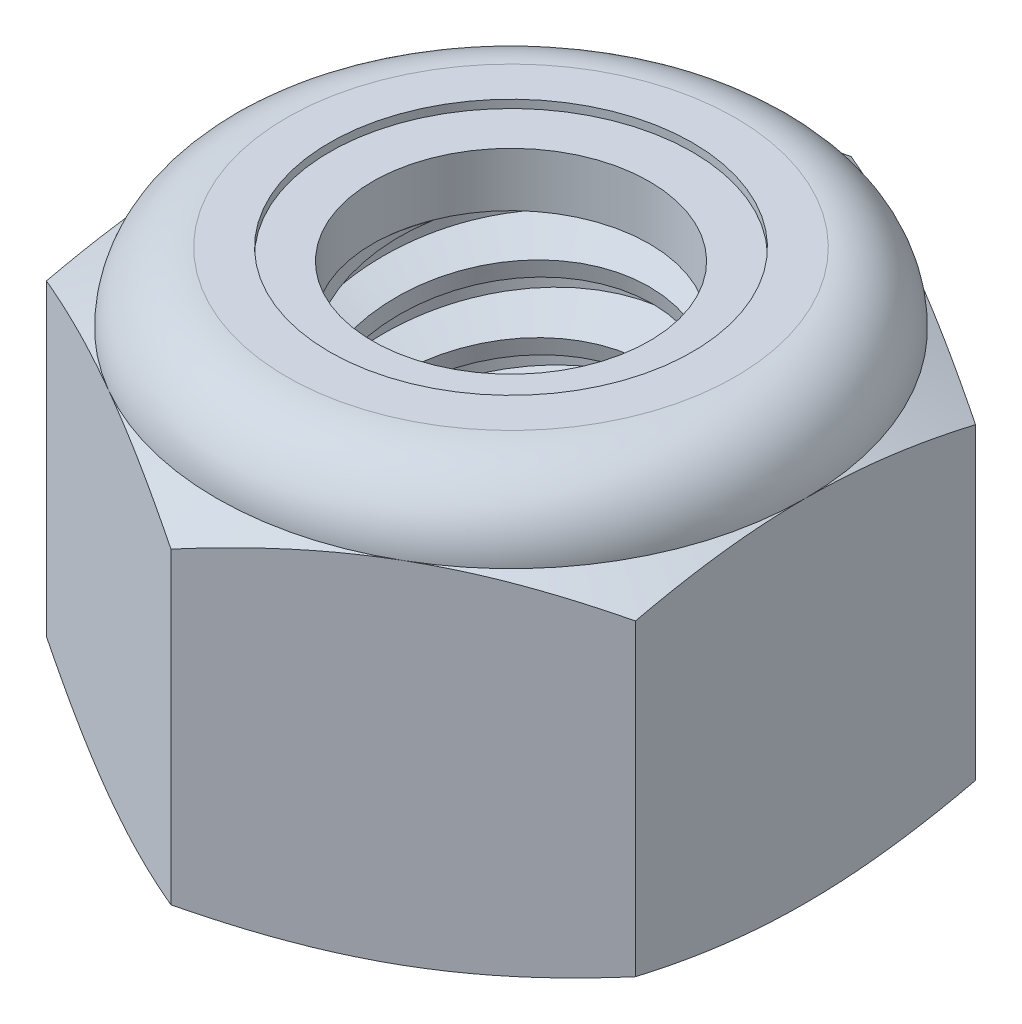
from build123d import *

# Parameters (mm, degrees)
EXTRUDE1_DEPTH       = 7.9375
SKETCH2_W            = 3.175
SKETCH2_H            = 7.9375
LPATTERN1_COUNT      = 6
LPATTERN1_PITCH      = 1.27
LPATTERN1_COUNT_DIR2 = 2
LPATTERN1_PITCH_DIR2 = 1.27


with BuildPart() as part:
    # Sketch1 → Extrude1 (new body)
    with BuildSketch(Plane(origin=(0, 0, 0), x_dir=(1, 0, 0), z_dir=(0, 1, 0))):
        Polygon((0, 6.415804866), (-5.55625, 3.207902433), (-5.55625, -3.207902433), (0, -6.415804866), (5.55625, -3.207902433), (5.55625, 3.207902433), align=None)
    extrude(amount=EXTRUDE1_DEPTH)

    # Sketch4 → Cut-Revolve2 (revolve, cut)
    with BuildSketch(Plane(origin=(0, 0, 0), x_dir=(0, 0, -1), z_dir=(1, 0, 0))):
        Polygon((0, 7.9375), (3.175, 7.9375), (2.609908356, 7.673993439), (2.609908356, 0.263506561), (3.175, 0), (0, 0), align=None)
    revolve(axis=Axis((0, 7.9375, 0), (0, 1, 0)), mode=Mode.SUBTRACT)


with BuildPart() as body_2:
    # Sketch2 → Revolve1 (revolve)
    with BuildSketch(Plane(origin=(0, 0, 0), x_dir=(0, 0, -1), z_dir=(1, 0, 0))):
        with Locations((1.5875, 3.96875)):
            Rectangle(SKETCH2_W, SKETCH2_H)
    revolve(axis=Axis((0, -3.175, 0), (0, 1, 0)))

    # Sketch3 → Cut-Revolve1 (revolve, cut)
    with BuildSketch(Plane(origin=(0, 0, 0), x_dir=(0, 0, -1), z_dir=(1, 0, 0))):
        Polygon((3.206133436, 7.781832818), (3.424067492, 6.692162542), (2.672175229, 6.946518763), (2.609908356, 7.257853128), align=None)
    cut_revolve1 = revolve(axis=Axis((0, 7.9375, 0.272704483), (0, -0.9805806756909201, -0.19611613513818418)), mode=Mode.SUBTRACT)

    # LPattern1: Cut-Revolve1 6 × 2
    with Locations(*[Vector(0, -1, 0) * (i * LPATTERN1_PITCH) + Vector(0, 1, 0) * (j * LPATTERN1_PITCH_DIR2) for i in range(LPATTERN1_COUNT) for j in range(LPATTERN1_COUNT_DIR2) if (i, j) != (0, 0)]):
        add(cut_revolve1, mode=Mode.SUBTRACT)


with BuildPart() as part_1:
    add(part.part)

    # Combine1: cut body 2
    add(body_2.part, mode=Mode.SUBTRACT)

    # Sketch5 → Cut-Revolve3 (revolve, cut)
    with BuildSketch(Plane(origin=(0, 0, 0), x_dir=(0, 0, -1), z_dir=(1, 0, 0))):
        with BuildLine():
            Line((0, 0), (5.55625, 0))
            Line((5.55625, 0), (6.415804866, 0.400817017))
            Line((6.415804866, 0.400817017), (6.415804866, 6.213766317))
            Line((6.415804866, 6.213766317), (5.55625, 6.614583333))
            ThreePointArc((5.55625, 6.614583333), (5.168776679, 7.550026679), (4.233333333, 7.9375))
            Line((4.233333333, 7.9375), (4.233333333, 9.2075))
            Line((4.233333333, 9.2075), (7.685804866, 9.2075))
            Line((7.685804866, 9.2075), (7.685804866, -1.27))
            Line((7.685804866, -1.27), (0, -1.27))
            Line((0, -1.27), (0, 0))
        make_face()
    revolve(axis=Axis((0, 0, 0), (0, 1, 0)), mode=Mode.SUBTRACT)

    # Sketch6 → Cut-Revolve4 (revolve, cut)
    with BuildSketch(Plane(origin=(0, 0, 0), x_dir=(0, 0, -1), z_dir=(1, 0, 0))):
        with BuildLine():
            Line((0, 6.614583333), (5.40385, 6.614583333))
            ThreePointArc((5.40385, 6.614583333), (5.061013606, 7.442263606), (4.233333333, 7.7851))
            Line((4.233333333, 7.7851), (3.421620845, 7.7851))
            Line((3.421620845, 7.7851), (3.421620845, 9.2075))
            Line((3.421620845, 9.2075), (0, 9.2075))
            Line((0, 9.2075), (0, 6.614583333))
        make_face()
    revolve(axis=Axis((0, 9.2075, 0), (0, 1, 0)), mode=Mode.SUBTRACT)


with BuildPart() as body_2_2:
    # Sketch7 → Revolve2 (revolve)
    with BuildSketch(Plane(origin=(0, 0, 0), x_dir=(0, 0, -1), z_dir=(1, 0, 0))):
        with BuildLine():
            Line((2.609908356, 6.690783333), (5.324993778, 6.690783333))
            ThreePointArc((5.324993778, 6.690783333), (4.979705237, 7.4148695), (4.233333333, 7.7089))
            Line((4.233333333, 7.7089), (2.609908356, 7.7089))
            Line((2.609908356, 7.7089), (2.609908356, 6.690783333))
        make_face()
    revolve(axis=Axis((0, 6.690783333, 0), (0, 1, 0)))


solid = Compound([part_1.part, body_2_2.part])
